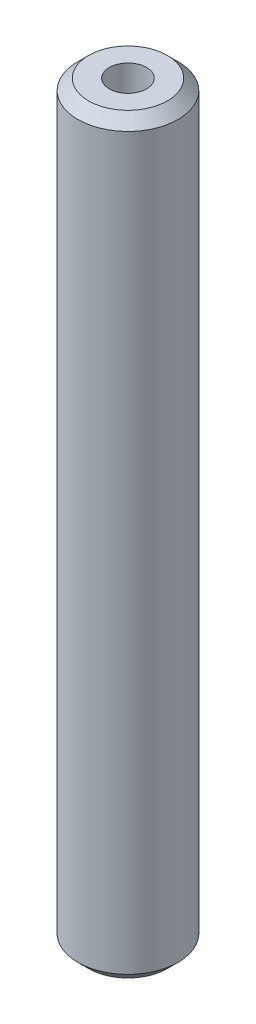
from build123d import *

# Parameters (mm, degrees)
SKETCH1_R           = 25
BOSS_EXTRUDE1_DEPTH = 374.822982687
SKETCH2_R           = 9.286841313
CUT_EXTRUDE1_DEPTH  = 377.486743924
CHAMFER1_SIZE       = 5.346426369


with BuildPart() as part:
    # Sketch1 → Boss-Extrude1 (new body)
    with BuildSketch(Plane(origin=(0, 0, 0), x_dir=(1, 0, 0), z_dir=(0, 1, 0))):
        Circle(SKETCH1_R)
    extrude(amount=BOSS_EXTRUDE1_DEPTH)

    # Sketch2 → Cut-Extrude1 (cut, through all)
    with BuildSketch(Plane(origin=(0, 0, 0), x_dir=(1, 0, 0), z_dir=(0, 1, 0))):
        Circle(SKETCH2_R)
    extrude(amount=CUT_EXTRUDE1_DEPTH, mode=Mode.SUBTRACT)

    # Chamfer1
    chamfer1_edges = [part.edges().sort_by_distance(p)[0] for p in [
        (-25, 374.822982687, 0),
        (-25, 0, 0),
    ]]
    chamfer(chamfer1_edges, length=CHAMFER1_SIZE)


solid = part.part
